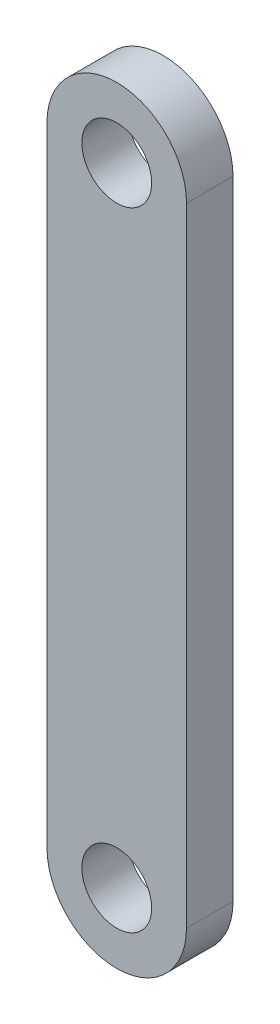
from build123d import *

# Parameters (mm, degrees)
SKETCH1_R           = 7.5
BOSS_EXTRUDE1_DEPTH = 10


with BuildPart() as part:
    # Sketch1 → Boss-Extrude1 (new body)
    with BuildSketch(Plane.XY):
        with BuildLine():
            Line((-15, 135), (-15, 0))
            ThreePointArc((-15, 0), (0, -15), (15, 0))
            Line((15, 0), (15, 135))
            ThreePointArc((15, 135), (0, 150), (-15, 135))
        make_face()
        with Locations((0, 135)):
            Circle(SKETCH1_R, mode=Mode.SUBTRACT)
        Circle(SKETCH1_R, mode=Mode.SUBTRACT)
    extrude(amount=BOSS_EXTRUDE1_DEPTH)


solid = part.part
